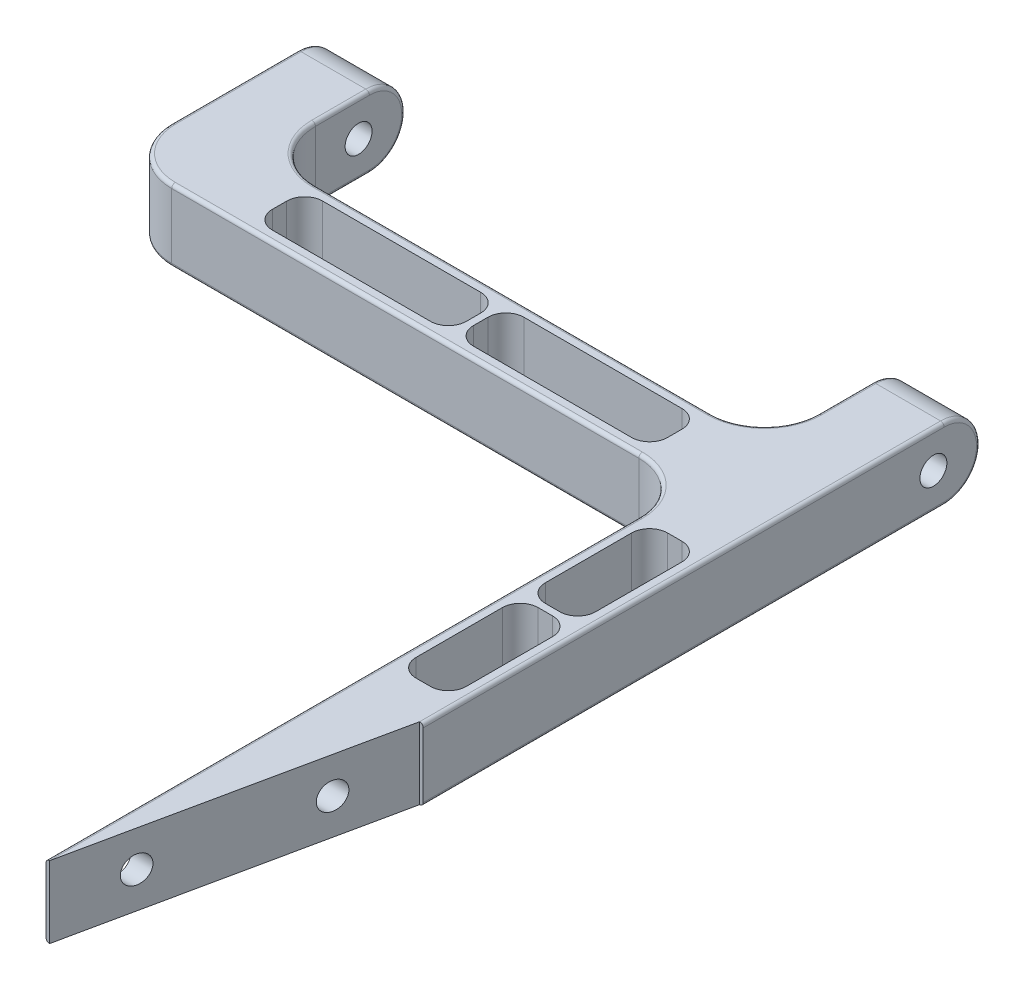
from build123d import *

# Parameters (mm, degrees)
BOSS_EXTRUDE1_DEPTH     = 25.4
CUT_EXTRUDE3_REACH      = 349.398
FILLET1_R               = 1.27
CUT_EXTRUDE4_REACH      = 333.236
SKETCH4_R               = 4.7625
FILLET2_R               = 12.7
CUT_EXTRUDE5_DEPTH      = 332.236354444
CUT_EXTRUDE5_DEPTH_BACK = 332.236354444
SKETCH17_R              = 4.7625
SKETCH18_W              = 68.58
SKETCH18_H              = 17.78
SKETCH18_W_2            = 17.78
SKETCH18_H_2            = 43.18
CUT_EXTRUDE6_DEPTH      = 19.05
FILLET3_R               = 6.35


with BuildPart() as part:
    # Sketch1 → Boss-Extrude1 (new body)
    with BuildSketch(Plane(origin=(0, 0, 0), x_dir=(1, 0, 0), z_dir=(0, 1, 0))):
        with BuildLine():
            Line((44.45, -6.35), (184.15, -6.35))
            ThreePointArc((184.15, -6.35), (197.620384182, -0.770384182), (203.2, 12.7))
            Line((203.2, 12.7), (203.2, 44.45))
            Line((203.2, 44.45), (228.6, 44.45))
            Line((228.6, 44.45), (228.6, -260.35))
            Line((228.6, -260.35), (203.2, -260.35))
            Line((203.2, -260.35), (203.2, -50.8))
            ThreePointArc((203.2, -50.8), (197.620384182, -37.329615818), (184.15, -31.75))
            Line((184.15, -31.75), (19.05, -31.75))
            ThreePointArc((19.05, -31.75), (5.579615818, -26.170384182), (0, -12.7))
            Line((0, -12.7), (0, 44.45))
            Line((0, 44.45), (25.4, 44.45))
            Line((25.4, 44.45), (25.4, 12.7))
            ThreePointArc((25.4, 12.7), (30.979615818, -0.770384182), (44.45, -6.35))
        make_face()
    extrude(amount=BOSS_EXTRUDE1_DEPTH)

    # Sketch3 → Cut-Extrude3 (cut, up to next)
    with BuildSketch(Plane(origin=(0, 25.4, 0), x_dir=(1, 0, 0), z_dir=(0, 1, 0)), mode=Mode.PRIVATE) as cut_extrude3_sk1:
        Polygon((215.9, -260.35), (228.6, -260.35), (228.6, -152.4), (227.33, -152.4), (204.47, -260.35), align=None)
    cut_extrude3_tool1 = extrude(cut_extrude3_sk1.sketch, amount=-CUT_EXTRUDE3_REACH, mode=Mode.PRIVATE) & part.part
    add(cut_extrude3_tool1.solids().sort_by_distance((220.5355, 25.4, 222.5675))[0], mode=Mode.SUBTRACT)

    # Fillet1
    fillet1_edges = [part.edges().sort_by_distance(p)[0] for p in [
        (0, 12.7, -44.45),
        (25.4, 12.7, -44.45),
        (203.2, 12.7, -44.45),
        (228.6, 12.7, -44.45),
        (228.6, 0, 53.975),
        (203.2, 0, 155.575),
        (197.620384182, 0, 37.329615818),
        (5.579615818, 0, 26.170384182),
        (101.6, 0, 31.75),
        (197.620384182, 0, 0.770384182),
        (203.2, 0, -28.575),
        (114.3, 0, 6.35),
        (30.979615818, 0, 0.770384182),
        (25.4, 0, -28.575),
        (0, 0, -15.875),
        (25.4, 25.4, -28.575),
        (30.979615818, 25.4, 0.770384182),
        (114.3, 25.4, 6.35),
        (197.620384182, 25.4, 0.770384182),
        (203.2, 25.4, -28.575),
        (228.6, 25.4, 53.975),
        (203.2, 25.4, 155.575),
        (197.620384182, 25.4, 37.329615818),
        (101.6, 25.4, 31.75),
        (5.579615818, 25.4, 26.170384182),
        (0, 25.4, -15.875),
    ]]
    fillet(fillet1_edges, radius=FILLET1_R)

    # Cut-Extrude4: up to this plane
    cut_extrude4_end = Plane(origin=(248.460888859, -0.001, 52.615247053), z_dir=(-0.9783048645494203, 0, -0.20717044190458336))
    # Sketch4 → Cut-Extrude4 (cut, up to the surface)
    with BuildSketch(Plane.ZY.offset(-203.2), mode=Mode.PRIVATE) as cut_extrude4_sk1:
        with BuildLine():
            ThreePointArc((182.5625, 12.7), (177.8, 17.4625), (173.0375, 12.7))
            Line((173.0375, 12.7), (182.5625, 12.7))
        make_face()
    cut_extrude4_tool1 = split(extrude(cut_extrude4_sk1.sketch, amount=-CUT_EXTRUDE4_REACH, mode=Mode.PRIVATE), bisect_by=cut_extrude4_end, keep=Keep.BOTH, mode=Mode.PRIVATE)
    add(cut_extrude4_tool1.solids().sort_by_distance((203.2, 14.721268, 177.8))[0], mode=Mode.SUBTRACT)
    # Sketch4 → Cut-Extrude4 (cut, up to the surface)
    with BuildSketch(Plane.ZY.offset(-203.2), mode=Mode.PRIVATE) as cut_extrude4_sk2:
        with BuildLine():
            Line((182.5625, 12.7), (173.0375, 12.7))
            ThreePointArc((173.0375, 12.7), (177.8, 7.9375), (182.5625, 12.7))
        make_face()
    cut_extrude4_tool2 = split(extrude(cut_extrude4_sk2.sketch, amount=-CUT_EXTRUDE4_REACH, mode=Mode.PRIVATE), bisect_by=cut_extrude4_end, keep=Keep.BOTH, mode=Mode.PRIVATE)
    add(cut_extrude4_tool2.solids().sort_by_distance((203.2, 10.678732, 177.8))[0], mode=Mode.SUBTRACT)
    # Sketch4 → Cut-Extrude4 (cut, up to the surface)
    with BuildSketch(Plane.ZY.offset(-203.2), mode=Mode.PRIVATE) as cut_extrude4_sk3:
        with BuildLine():
            ThreePointArc((182.5625, 12.7), (177.8, 17.4625), (173.0375, 12.7))
            Line((173.0375, 12.7), (182.5625, 12.7))
        make_face()
    cut_extrude4_tool3 = split(extrude(cut_extrude4_sk3.sketch, amount=-CUT_EXTRUDE4_REACH, mode=Mode.PRIVATE), bisect_by=cut_extrude4_end, keep=Keep.BOTH, mode=Mode.PRIVATE)
    add(cut_extrude4_tool3.solids().sort_by_distance((203.2, 14.721268, 177.8))[0], mode=Mode.SUBTRACT)
    # Sketch4 → Cut-Extrude4 (cut, up to the surface)
    with BuildSketch(Plane.ZY.offset(-203.2), mode=Mode.PRIVATE) as cut_extrude4_sk4:
        with BuildLine():
            Line((182.5625, 12.7), (173.0375, 12.7))
            ThreePointArc((173.0375, 12.7), (177.8, 7.9375), (182.5625, 12.7))
        make_face()
    cut_extrude4_tool4 = split(extrude(cut_extrude4_sk4.sketch, amount=-CUT_EXTRUDE4_REACH, mode=Mode.PRIVATE), bisect_by=cut_extrude4_end, keep=Keep.BOTH, mode=Mode.PRIVATE)
    add(cut_extrude4_tool4.solids().sort_by_distance((203.2, 10.678732, 177.8))[0], mode=Mode.SUBTRACT)
    # Sketch4 → Cut-Extrude4 (cut, up to the surface)
    with BuildSketch(Plane.ZY.offset(-203.2), mode=Mode.PRIVATE) as cut_extrude4_sk5:
        with Locations((234.95, 12.7)):
            Circle(SKETCH4_R)
    cut_extrude4_tool5 = split(extrude(cut_extrude4_sk5.sketch, amount=-CUT_EXTRUDE4_REACH, mode=Mode.PRIVATE), bisect_by=cut_extrude4_end, keep=Keep.BOTH, mode=Mode.PRIVATE)
    add(cut_extrude4_tool5.solids().sort_by_distance((203.2, 12.7, 234.95))[0], mode=Mode.SUBTRACT)

    # Fillet2
    # the kernel refuses this fillet: 12.7 mm, written as the material it takes off along each edge
    with BuildSketch(Plane(origin=(0, 12.7, -31.75), x_dir=(0, 1, 0), z_dir=(0, 0, 1))) as fillet2_piece_1:
        with BuildLine():
            CenterArc((11.43, -1.27), 1.27, 0, 90)
            Line((12.7, -1.27), (12.7, 0))
            Line((12.7, 0), (11.43, 0))
        make_face()
    revolve(axis=Axis((0, 12.7, -31.75), (-1, 0, 0)), revolution_arc=90, mode=Mode.SUBTRACT)
    with BuildSketch(Plane(origin=(25.4, 12.7, -31.75), x_dir=(0, 0, -1), z_dir=(0, -1, 0))) as fillet2_piece_2:
        with BuildLine():
            CenterArc((11.43, -1.27), 1.27, 0, 90)
            Line((12.7, -1.27), (12.7, 0))
            Line((12.7, 0), (11.43, 0))
        make_face()
    revolve(axis=Axis((25.4, 12.7, -31.75), (1, 0, 0)), revolution_arc=90, mode=Mode.SUBTRACT)
    with BuildSketch(Plane(origin=(203.2, 12.7, -31.75), x_dir=(0, 0, -1), z_dir=(0, 1, 0))) as fillet2_piece_3:
        with BuildLine():
            CenterArc((11.43, -1.27), 1.27, 0, 90)
            Line((12.7, -1.27), (12.7, 0))
            Line((12.7, 0), (11.43, 0))
        make_face()
    revolve(axis=Axis((203.2, 12.7, -31.75), (-1, 0, 0)), revolution_arc=90, mode=Mode.SUBTRACT)
    with BuildSketch(Plane(origin=(228.6, 12.7, -31.75), x_dir=(0, -1, 0), z_dir=(0, 0, 1))) as fillet2_piece_4:
        with BuildLine():
            CenterArc((11.43, -1.27), 1.27, 0, 90)
            Line((12.7, -1.27), (12.7, 0))
            Line((12.7, 0), (11.43, 0))
        make_face()
    revolve(axis=Axis((228.6, 12.7, -31.75), (1, 0, 0)), revolution_arc=90, mode=Mode.SUBTRACT)
    with BuildSketch(Plane(origin=(203.2, 12.7, -31.75), x_dir=(0, 1, 0), z_dir=(0, 0, 1))) as fillet2_piece_5:
        with BuildLine():
            CenterArc((11.43, -1.27), 1.27, 0, 90)
            Line((12.7, -1.27), (12.7, 0))
            Line((12.7, 0), (11.43, 0))
        make_face()
    revolve(axis=Axis((203.2, 12.7, -31.75), (-1, 0, 0)), revolution_arc=90, mode=Mode.SUBTRACT)
    with BuildSketch(Plane(origin=(228.6, 12.7, -31.75), x_dir=(0, 0, -1), z_dir=(0, -1, 0))) as fillet2_piece_6:
        with BuildLine():
            CenterArc((11.43, -1.27), 1.27, 0, 90)
            Line((12.7, -1.27), (12.7, 0))
            Line((12.7, 0), (11.43, 0))
        make_face()
    revolve(axis=Axis((228.6, 12.7, -31.75), (1, 0, 0)), revolution_arc=90, mode=Mode.SUBTRACT)
    with BuildSketch(Plane(origin=(0, 12.7, -31.75), x_dir=(0, 0, -1), z_dir=(0, 1, 0))) as fillet2_piece_7:
        with BuildLine():
            CenterArc((11.43, -1.27), 1.27, 0, 90)
            Line((12.7, -1.27), (12.7, 0))
            Line((12.7, 0), (11.43, 0))
        make_face()
    revolve(axis=Axis((0, 12.7, -31.75), (-1, 0, 0)), revolution_arc=90, mode=Mode.SUBTRACT)
    with BuildSketch(Plane(origin=(25.4, 12.7, -31.75), x_dir=(0, -1, 0), z_dir=(0, 0, 1))) as fillet2_piece_8:
        with BuildLine():
            CenterArc((11.43, -1.27), 1.27, 0, 90)
            Line((12.7, -1.27), (12.7, 0))
            Line((12.7, 0), (11.43, 0))
        make_face()
    revolve(axis=Axis((25.4, 12.7, -31.75), (1, 0, 0)), revolution_arc=90, mode=Mode.SUBTRACT)
    with BuildSketch(Plane(origin=(203.2, 25.4, -44.45), x_dir=(0, 0, 1), z_dir=(1, 0, 0)), Plane(origin=(0, 25.4, -44.45), x_dir=(0, 0, 1), z_dir=(1, 0, 0))) as fillet2_piece_9:
        with BuildLine():
            CenterArc((FILLET2_R, FILLET2_R), FILLET2_R, 180, 90)
            Line((0, FILLET2_R), (0, 0))
            Line((0, 0), (FILLET2_R, 0))
        make_face()
    extrude(amount=25.4, mode=Mode.SUBTRACT)
    with BuildSketch(Plane(origin=(203.2, 0, -44.45), x_dir=(0, 0, 1), z_dir=(1, 0, 0)), Plane(origin=(0, 0, -44.45), x_dir=(0, 0, 1), z_dir=(1, 0, 0))) as fillet2_piece_10:
        with BuildLine():
            CenterArc((FILLET2_R, -FILLET2_R), FILLET2_R, 90, 90)
            Line((0, -FILLET2_R), (0, 0))
            Line((0, 0), (FILLET2_R, 0))
        make_face()
    extrude(amount=25.4, mode=Mode.SUBTRACT)

    # Sketch17 → Cut-Extrude5 (cut, two sides: drawn at the far end of the back side and taken through both)
    with BuildSketch(Plane.ZY.offset(-203.2).offset(-CUT_EXTRUDE5_DEPTH_BACK)):
        with Locations((-27.94, 12.7)):
            Circle(SKETCH17_R)
    extrude(amount=CUT_EXTRUDE5_DEPTH + CUT_EXTRUDE5_DEPTH_BACK, mode=Mode.SUBTRACT)

    # Sketch18 → Cut-Extrude6 (cut)
    with BuildSketch(Plane(origin=(0, 25.4, 0), x_dir=(1, 0, 0), z_dir=(0, 1, 0))):
        with Locations((78.74, -19.05)):
            Rectangle(SKETCH18_W, SKETCH18_H)
        with Locations((149.86, -19.05)):
            Rectangle(SKETCH18_W, SKETCH18_H)
        with Locations((215.9, -72.39)):
            Rectangle(SKETCH18_W_2, SKETCH18_H_2)
        with Locations((215.9, -118.11)):
            Rectangle(SKETCH18_W_2, SKETCH18_H_2)
    extrude(amount=-CUT_EXTRUDE6_DEPTH, mode=Mode.SUBTRACT)

    # Fillet3
    fillet3_edges = [part.edges().sort_by_distance(p)[0] for p in [
        (224.79, 15.875, 96.52),
        (224.79, 15.875, 139.7),
        (207.01, 15.875, 139.7),
        (207.01, 15.875, 96.52),
        (224.79, 15.875, 50.8),
        (224.79, 15.875, 93.98),
        (207.01, 15.875, 93.98),
        (207.01, 15.875, 50.8),
        (115.57, 15.875, 10.16),
        (184.15, 15.875, 10.16),
        (184.15, 15.875, 27.94),
        (115.57, 15.875, 27.94),
        (113.03, 15.875, 10.16),
        (113.03, 15.875, 27.94),
        (44.45, 15.875, 27.94),
        (44.45, 15.875, 10.16),
    ]]
    fillet(fillet3_edges, radius=FILLET3_R)


solid = part.part
